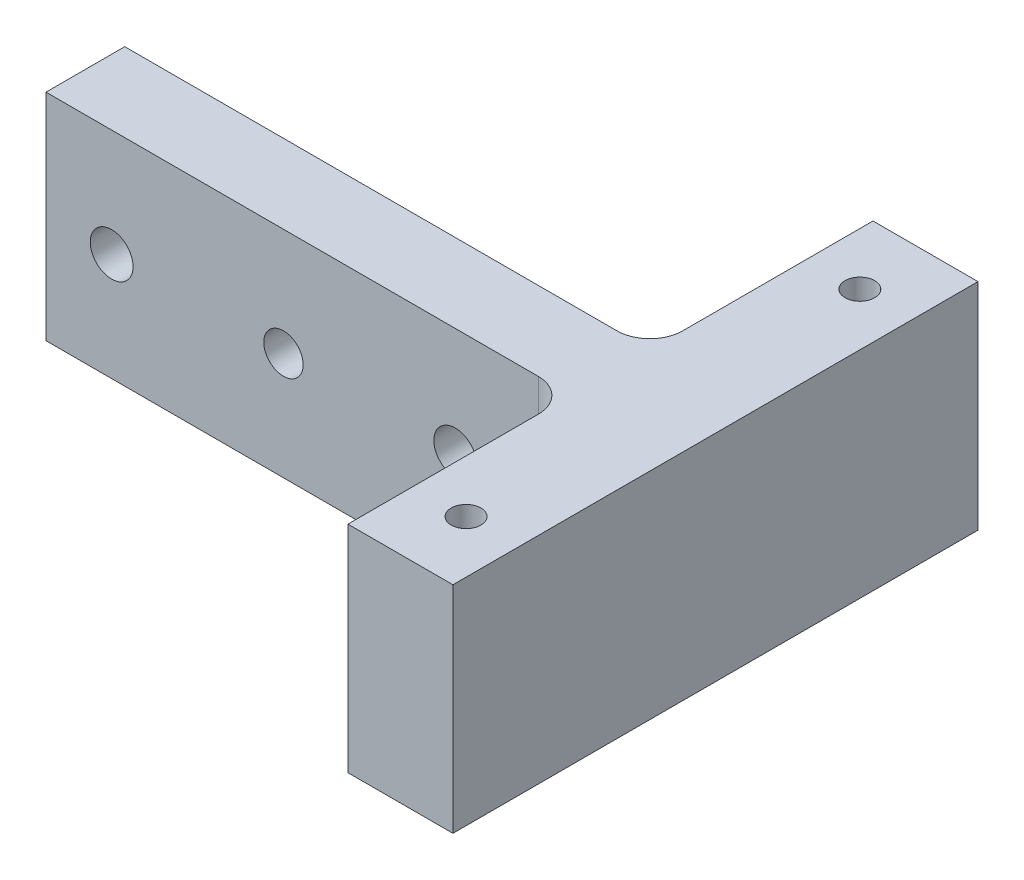
from build123d import *

# Parameters (mm, degrees)
BOSS_EXTRUDE1_DEPTH   = 16.4
F_4_40_TAPPED_HOLE1_D = 2.2606
F_3_0MM_DOWEL_HOLE1_D = 3
F_4_CLEARANCE_HOLE1_D = 3.2639
FILLET1_R             = 2.5


with BuildPart() as part:
    # Sketch1 → Boss-Extrude1 (new body)
    with BuildSketch(Plane(origin=(0, 0, 0), x_dir=(1, 0, 0), z_dir=(0, 1, 0))):
        Polygon((-4, -3), (-4, -20), (4, -20), (4, 20), (-4, 20), (-4, 3), (-44, 3), (-44, -3), align=None)
    extrude(amount=BOSS_EXTRUDE1_DEPTH)

    # #4-40 Tapped Hole1 (through all)
    with Locations(Plane(origin=(0, 16.4, 0), x_dir=(1, 0, 0), z_dir=(0, 1, 0))):
        with Locations((0, 15), (0, -15)):
            Hole(F_4_40_TAPPED_HOLE1_D / 2)

    # Ø3.0mm Dowel Hole1 (through all)
    with Locations(Plane.XY.offset(3)):
        with Locations((-25.91, 8.2)):
            Hole(F_3_0MM_DOWEL_HOLE1_D / 2)

    # #4 Clearance Hole1 (through all)
    with Locations(Plane.XY.offset(3)):
        with Locations((-39, 8.2), (-12.82, 8.2)):
            Hole(F_4_CLEARANCE_HOLE1_D / 2)

    # Fillet1
    fillet1_edges = [part.edges().sort_by_distance(p)[0] for p in [
        (-4, 8.2, -3),
        (-4, 8.2, 3),
    ]]
    fillet(fillet1_edges, radius=FILLET1_R)


solid = part.part
